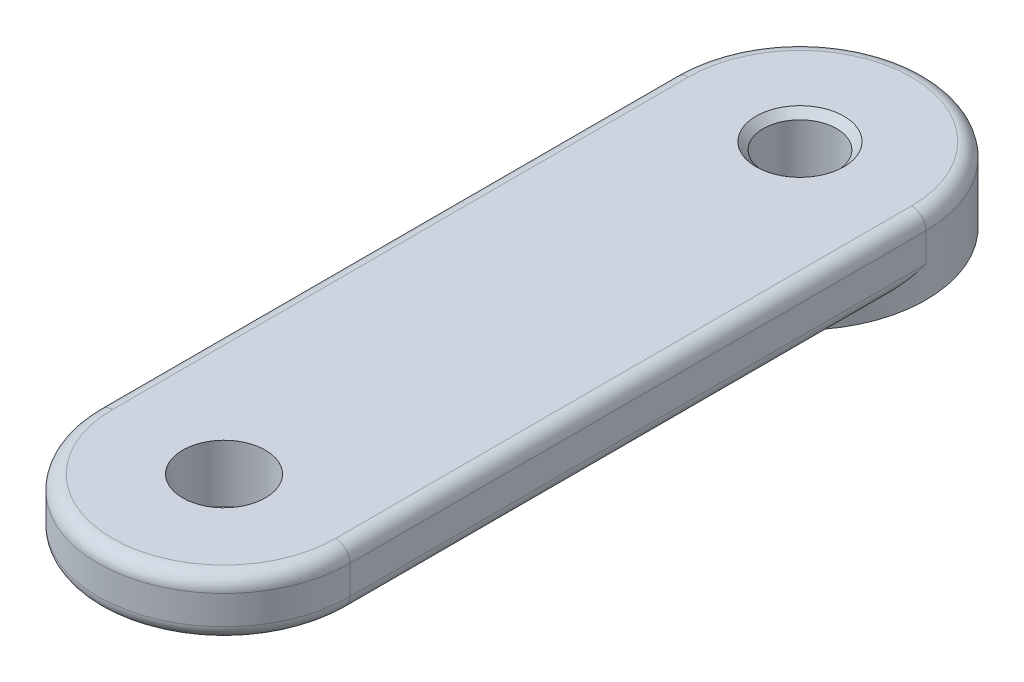
from build123d import *
from build123d.topology import SkipClean

# Parameters (mm, degrees)
SKETCH1_R           = 2.55
SKETCH1_R_2         = 2.875
BOSS_EXTRUDE1_DEPTH = 4
BOSS_EXTRUDE2_START = 5
SKETCH3_R           = 8.75
SKETCH3_R_2         = 2.55
BOSS_EXTRUDE2_DEPTH = 5
FILLET2_R           = 1
SKETCH5_R           = 8.75
CUT_EXTRUDE2_DEPTH  = 3.84


with BuildPart() as part:
    # Sketch1 → Boss-Extrude1 (new body)
    with BuildSketch(Plane(origin=(0, 0, 0), x_dir=(1, 0, 0), z_dir=(0, 1, 0))):
        with BuildLine():
            Line((-8.75, 0), (-8.75, 40))
            ThreePointArc((-8.75, 40), (0, 48.75), (8.75, 40))
            Line((8.75, 40), (8.75, 0))
            ThreePointArc((8.75, 0), (0, -8.75), (-8.75, 0))
        make_face()
        with Locations(Location((0, 40, 0), (0, 0, 270))):
            Circle(SKETCH1_R, mode=Mode.SUBTRACT)
        with Locations(Location((0, 0, 0), (0, 0, 270))):
            Circle(SKETCH1_R_2, mode=Mode.SUBTRACT)
    extrude(amount=BOSS_EXTRUDE1_DEPTH)

    # Sketch3 → Boss-Extrude2 (add)
    with SkipClean():  # the faces are left unmerged after this step: merging them gives an invalid solid
        with BuildSketch(Plane.XZ.offset(BOSS_EXTRUDE2_START)):
            with Locations(Location((0, -40, 0), (0, 0, 270))):
                Circle(SKETCH3_R)
            with Locations(Location((0, -40, 0), (0, 0, 270))):
                Circle(SKETCH3_R_2, mode=Mode.SUBTRACT)
        extrude(amount=-BOSS_EXTRUDE2_DEPTH)

    # Fillet2
    # the kernel refuses this fillet: 1 mm, written as the material it takes off along each edge
    with BuildSketch(Plane(origin=(0, 4, -40), x_dir=(-1, 0, 0), z_dir=(0, 0, 1))) as fillet2_piece_1:
        with BuildLine():
            CenterArc((8.75 - FILLET2_R, FILLET2_R), FILLET2_R, 270, 90)
            Line((8.75 - FILLET2_R, 0), (8.75, 0))
            Line((8.75, 0), (8.75, FILLET2_R))
        make_face()
    revolve(axis=Axis((0, 4, -40), (0, -1, 0)), revolution_arc=180, mode=Mode.SUBTRACT)
    with BuildSketch(Plane(origin=(-8.75, 4, 0), x_dir=(1, 0, 0), z_dir=(0, 0, -1))) as fillet2_piece_2:
        with BuildLine():
            CenterArc((FILLET2_R, FILLET2_R), FILLET2_R, 180, 90)
            Line((0, FILLET2_R), (0, 0))
            Line((0, 0), (FILLET2_R, 0))
        make_face()
    extrude(amount=40, mode=Mode.SUBTRACT)
    with BuildSketch(Plane(origin=(0, -5, -40), x_dir=(0, 0, -1), z_dir=(-1, 0, 0))) as fillet2_piece_3:
        with BuildLine():
            CenterArc((8.75 - FILLET2_R, -FILLET2_R), FILLET2_R, 0, 90)
            Line((8.75 - FILLET2_R, 0), (8.75, 0))
            Line((8.75, 0), (8.75, -FILLET2_R))
        make_face()
    revolve(axis=Axis((0, -5, -40), (0, -1, 0)), mode=Mode.SUBTRACT)
    with BuildSketch(Plane(origin=(0, 4, 0), x_dir=(1, 0, 0), z_dir=(0, 0, -1))) as fillet2_piece_4:
        with BuildLine():
            CenterArc((8.75 - FILLET2_R, FILLET2_R), FILLET2_R, 270, 90)
            Line((8.75 - FILLET2_R, 0), (8.75, 0))
            Line((8.75, 0), (8.75, FILLET2_R))
        make_face()
    revolve(axis=Axis((0, 4, 0), (0, -1, 0)), revolution_arc=180, mode=Mode.SUBTRACT)
    with BuildSketch(Plane(origin=(-8.75, 0, 0), x_dir=(1, 0, 0), z_dir=(0, 0, -1))) as fillet2_piece_5_section:
        with BuildLine():
            CenterArc((FILLET2_R, -FILLET2_R), FILLET2_R, 90, 90)
            Line((0, -FILLET2_R), (0, 0))
            Line((0, 0), (FILLET2_R, 0))
        make_face()
    fillet2_piece_5 = extrude(amount=44.25, mode=Mode.PRIVATE)
    fillet2_piece_5 = fillet2_piece_5 - Plane(origin=(0, 0, -40), x_dir=(0, 0, -1), z_dir=(0, -1, 0)) * Cylinder(8.75, 93, mode=Mode.PRIVATE)
    add(fillet2_piece_5, mode=Mode.SUBTRACT)
    with BuildSketch(Plane(origin=(8.75, 0, -44.25), x_dir=(0, 1, 0), z_dir=(0, 0, 1))) as fillet2_piece_6_section:
        with BuildLine():
            CenterArc((FILLET2_R, FILLET2_R), FILLET2_R, 180, 90)
            Line((0, FILLET2_R), (0, 0))
            Line((0, 0), (FILLET2_R, 0))
        make_face()
    fillet2_piece_6 = extrude(amount=44.25, mode=Mode.PRIVATE)
    fillet2_piece_6 = fillet2_piece_6 - Plane(origin=(0, 0, -40), x_dir=(0, 0, -1), z_dir=(0, -1, 0)) * Cylinder(8.75, 93, mode=Mode.PRIVATE)
    add(fillet2_piece_6, mode=Mode.SUBTRACT)
    with BuildSketch(Plane(origin=(0, 0, 0), x_dir=(1, 0, 0), z_dir=(0, 0, -1))) as fillet2_piece_7:
        with BuildLine():
            CenterArc((8.75 - FILLET2_R, -FILLET2_R), FILLET2_R, 0, 90)
            Line((8.75 - FILLET2_R, 0), (8.75, 0))
            Line((8.75, 0), (8.75, -FILLET2_R))
        make_face()
    revolve(axis=Axis((0, 0, 0), (0, -1, 0)), revolution_arc=180, mode=Mode.SUBTRACT)
    with BuildSketch(Plane(origin=(8.75, 4, -40), x_dir=(0, -1, 0), z_dir=(0, 0, 1))) as fillet2_piece_8:
        with BuildLine():
            CenterArc((FILLET2_R, -FILLET2_R), FILLET2_R, 90, 90)
            Line((0, -FILLET2_R), (0, 0))
            Line((0, 0), (FILLET2_R, 0))
        make_face()
    extrude(amount=40, mode=Mode.SUBTRACT)

    # Chamfer1: read off the stored shape, not the designer's step
    # Chamfer1 outline → Chamfer1 (revolve, cut)
    with BuildSketch(Plane.XY.offset(-40)):
        Polygon((3.05, -5), (2.55, -4.5), (2.55, -5), align=None)
        Polygon((2.55, 4), (2.55, 3.5), (3.05, 4), align=None)
    revolve(axis=Axis((0, 0, -40), (0, 1, 0)), mode=Mode.SUBTRACT)

    # Sketch5 → Cut-Extrude2 (cut)
    with BuildSketch(Plane.XZ.offset(5)):
        with Locations(Location((0, -40, 0), (0, 0, 270))):
            Circle(SKETCH5_R)
    extrude(amount=-CUT_EXTRUDE2_DEPTH, mode=Mode.SUBTRACT)


solid = part.part
